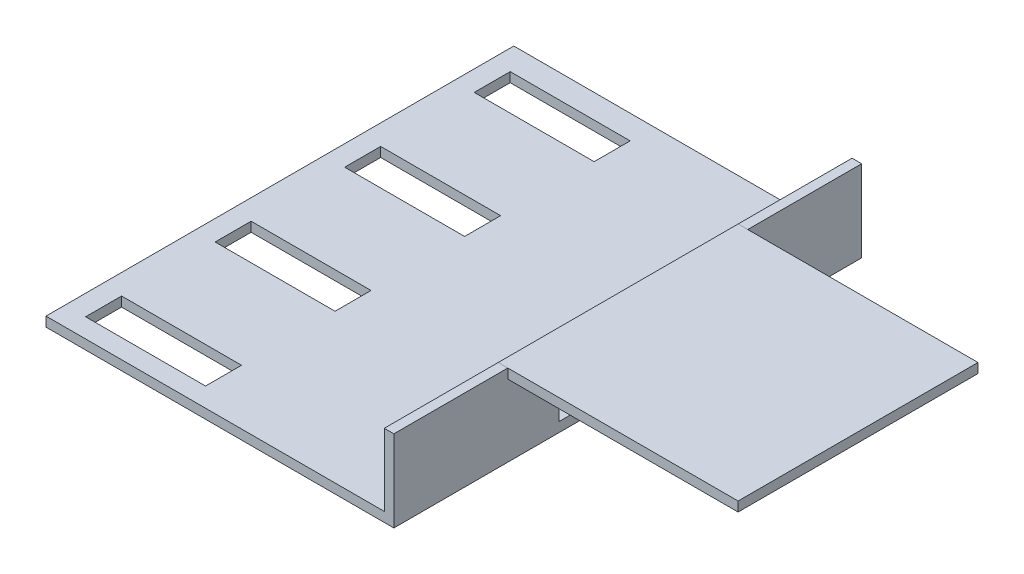
from build123d import *

# Parameters (mm, degrees)
SKETCH1_W           = 58
SKETCH1_H           = 78
BOSS_EXTRUDE1_DEPTH = 1.6
SKETCH2_W           = 1.6
SKETCH2_H           = 78
BOSS_EXTRUDE2_DEPTH = 12
SKETCH3_W           = 40
SKETCH3_H           = 40
BOSS_EXTRUDE3_DEPTH = 1.6
SKETCH4_W           = 23
SKETCH4_H           = 8.5
CUT_EXTRUDE1_DEPTH  = 1.6
SKETCH5_W           = 20
SKETCH5_H           = 6
CUT_EXTRUDE2_DEPTH  = 1.6
LPATTERN1_COUNT     = 4
LPATTERN1_PITCH     = 21.6


with BuildPart() as part:
    # Sketch1 → Boss-Extrude1 (new body)
    with BuildSketch(Plane(origin=(0, 0, 0), x_dir=(1, 0, 0), z_dir=(0, 1, 0))):
        Rectangle(SKETCH1_W, SKETCH1_H)
    extrude(amount=BOSS_EXTRUDE1_DEPTH)

    # Sketch2 → Boss-Extrude2 (add)
    with BuildSketch(Plane(origin=(0, 1.6, 0), x_dir=(1, 0, 0), z_dir=(0, 1, 0))):
        with Locations((28.2, 0)):
            Rectangle(SKETCH2_W, SKETCH2_H)
    extrude(amount=BOSS_EXTRUDE2_DEPTH)

    # Sketch4 → Cut-Extrude1 (cut)
    with BuildSketch(Plane.ZY.offset(-27.4)):
        with Locations((0, 5.85)):
            Rectangle(SKETCH4_W, SKETCH4_H)
    extrude(amount=-CUT_EXTRUDE1_DEPTH, mode=Mode.SUBTRACT)

    # Sketch5 → Cut-Extrude2 (cut)
    with BuildSketch(Plane(origin=(0, 1.6, 0), x_dir=(1, 0, 0), z_dir=(0, 1, 0))):
        with Locations((-15.6, 32)):
            Rectangle(SKETCH5_W, SKETCH5_H)
    cut_extrude2 = extrude(amount=-CUT_EXTRUDE2_DEPTH, mode=Mode.SUBTRACT)

    # LPattern1: Cut-Extrude2 ×4
    with Locations(*[(0, 0, i * LPATTERN1_PITCH) for i in range(1, LPATTERN1_COUNT)]):
        add(cut_extrude2, mode=Mode.SUBTRACT)


with BuildPart() as body_2:
    # Sketch3 → Boss-Extrude3 (new body)
    with BuildSketch(Plane(origin=(35.9, 13.6, -42.5), x_dir=(1, 0, 0), z_dir=(0, -1, 0))):
        with Locations((11.5, 42.5)):
            Rectangle(SKETCH3_W, SKETCH3_H)
    extrude(amount=BOSS_EXTRUDE3_DEPTH)


solid = Compound([part.part, body_2.part])
